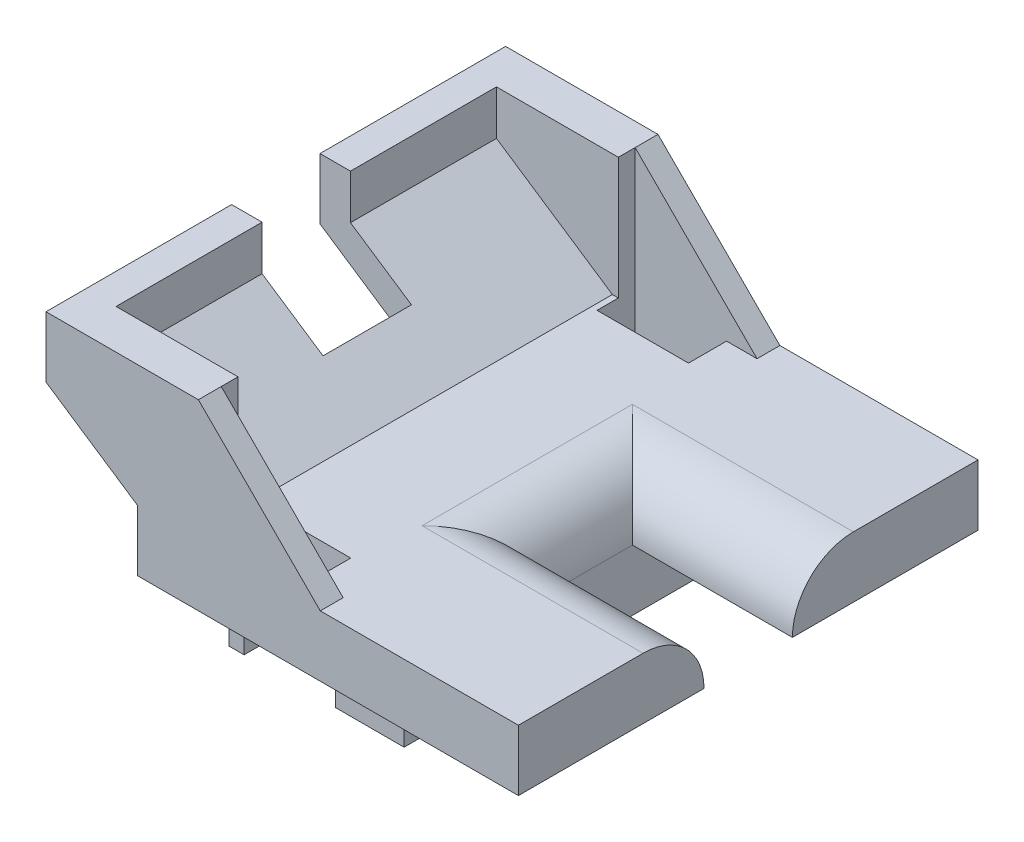
from build123d import *

# Parameters (mm, degrees)
BASE_DEPTH               = 1
SLOT_GUIDE_FILLET_1MM_R  = 1
SIDE_WALL_1_DEPTH        = 0.65
WALL_LINK_DEPTH          = 6.24
SKETCH4_W                = 2.875
SKETCH4_H                = 6.04
LOWER_FIT_DEPTH          = 1
CUT_THROUGH_REACH        = 9.184
SKETCH5_W                = 1.5
SKETCH5_H                = 1.45
SKETCH5_H_2              = 0.625
SKETCH6_W                = 0.5
SKETCH6_H                = 0.275
CUT_THROUGH_FINISH_DEPTH = 2
REAR_INSERT_DEPTH        = 0.725


with BuildPart() as part:
    # Sketch1 → Base (new body)
    with BuildSketch(Plane(origin=(0, 0, 0), x_dir=(1, 0, 0), z_dir=(0, 1, 0))):
        Polygon((3.125, 3.77), (3.125, 0.725), (0.5, 0.725), (0.5, -0.725), (3.125, -0.725), (3.125, -3.77), (-3.125, -3.77), (-3.125, 3.77), align=None)
    extrude(amount=BASE_DEPTH)

    # Slot Guide Fillet (1mm)
    slot_guide_fillet_1mm_edges = [part.edges().sort_by_distance(p)[0] for p in [
        (1.8125, 1, 0.725),
        (0.5, 1, 0),
        (1.8125, 1, -0.725),
    ]]
    fillet(slot_guide_fillet_1mm_edges, radius=SLOT_GUIDE_FILLET_1MM_R - 0.0001)  # a hair under: the kernel refuses the full size

    # Sketch2 → Side Wall 1 (add)
    with BuildSketch(Plane(origin=(0, 0, -3.77), x_dir=(-1, 0, 0), z_dir=(0, 0, -1))):
        Polygon((3.125, 1), (0.125, 1), (2.125, 3), (4.625, 3), (4.625, 2), align=None)
    side_wall_1 = extrude(amount=-SIDE_WALL_1_DEPTH)

    # Side Wall 2: Side Wall 1 across plane
    add(side_wall_1.mirror(Plane.XY))

    # Sketch3 → Wall Link (add)
    with BuildSketch(Plane.XY.offset(-3.12)):
        Polygon((-3.125, 1), (-4.625, 2), (-4.625, 3), (-4.125, 3), (-4.125, 2.267591879), (-2.223612181, 1), align=None)
    extrude(amount=WALL_LINK_DEPTH)

    # Sketch4 → Lower Fit (add)
    with BuildSketch(Plane.XZ):
        with Locations((-0.9375, 0)):
            Rectangle(SKETCH4_W, SKETCH4_H)
    extrude(amount=LOWER_FIT_DEPTH)

    # Cut Through: up to this face of the body (flat: up to its plane)
    cut_through_end = Plane(part.part.faces().sort_by_distance((-0.9375, -1, 0))[0])
    # Sketch5 → Cut Through (cut, up to the picked face)
    with BuildSketch(Plane(origin=(0, 3, 0), x_dir=(1, 0, 0), z_dir=(0, 1, 0)), mode=Mode.PRIVATE) as cut_through_sk1:
        with Locations((-3.875, 0)):
            Rectangle(SKETCH5_W, SKETCH5_H)
    cut_through_tool1 = split(extrude(cut_through_sk1.sketch, amount=-CUT_THROUGH_REACH, mode=Mode.PRIVATE), bisect_by=cut_through_end, keep=Keep.BOTH, mode=Mode.PRIVATE)
    # Sketch5 → Cut Through (cut, up to the picked face)
    with BuildSketch(Plane(origin=(0, 3, 0), x_dir=(1, 0, 0), z_dir=(0, 1, 0)), mode=Mode.PRIVATE) as cut_through_sk2:
        with Locations((-1.375, -3.0825)):
            Rectangle(SKETCH5_W, SKETCH5_H_2)
    cut_through_tool2 = split(extrude(cut_through_sk2.sketch, amount=-CUT_THROUGH_REACH, mode=Mode.PRIVATE), bisect_by=cut_through_end, keep=Keep.BOTH, mode=Mode.PRIVATE)
    # Sketch5 → Cut Through (cut, up to the picked face)
    with BuildSketch(Plane(origin=(0, 3, 0), x_dir=(1, 0, 0), z_dir=(0, 1, 0)), mode=Mode.PRIVATE) as cut_through_sk3:
        with Locations((-1.375, 3.0825)):
            Rectangle(SKETCH5_W, SKETCH5_H_2)
    cut_through_tool3 = split(extrude(cut_through_sk3.sketch, amount=-CUT_THROUGH_REACH, mode=Mode.PRIVATE), bisect_by=cut_through_end, keep=Keep.BOTH, mode=Mode.PRIVATE)
    add(cut_through_tool1.solids().sort_by(Axis((-3.875, 3, 0), (0, -1, 0)))[0], mode=Mode.SUBTRACT)
    add(cut_through_tool2.solids().sort_by(Axis((-1.375, 3, 3.0825), (0, -1, 0)))[0], mode=Mode.SUBTRACT)
    add(cut_through_tool3.solids().sort_by(Axis((-1.375, 3, -3.0825), (0, -1, 0)))[0], mode=Mode.SUBTRACT)

    # Sketch6 → Cut Through Finish (cut)
    with BuildSketch(Plane(origin=(0, 1, 0), x_dir=(1, 0, 0), z_dir=(0, 1, 0))):
        with Locations((-0.375, 3.2575)):
            Rectangle(SKETCH6_W, SKETCH6_H)
        with Locations((-0.375, -3.2575)):
            Rectangle(SKETCH6_W, SKETCH6_H)
    extrude(amount=CUT_THROUGH_FINISH_DEPTH, mode=Mode.SUBTRACT)

    # Sketch7 → Rear Insert (add, symmetric)
    with BuildSketch(Plane.XY):
        with BuildLine():
            Line((-3.125, -3), (-2.375, -3))
            Line((-2.375, -3), (-2.375, -1))
            Line((-2.375, -1), (-2.375, 0))
            Line((-2.375, 0), (-3.125, 0))
            Line((-3.125, 0), (-3.125, -0.75))
            ThreePointArc((-3.125, -0.75), (-3.198223305, -0.926776695), (-3.375, -1))
            Line((-3.375, -1), (-4.125, -1))
            Line((-4.125, -1), (-4.125, -2))
            Line((-4.125, -2), (-3.125, -3))
        make_face()
    extrude(amount=REAR_INSERT_DEPTH, both=True)


solid = part.part
